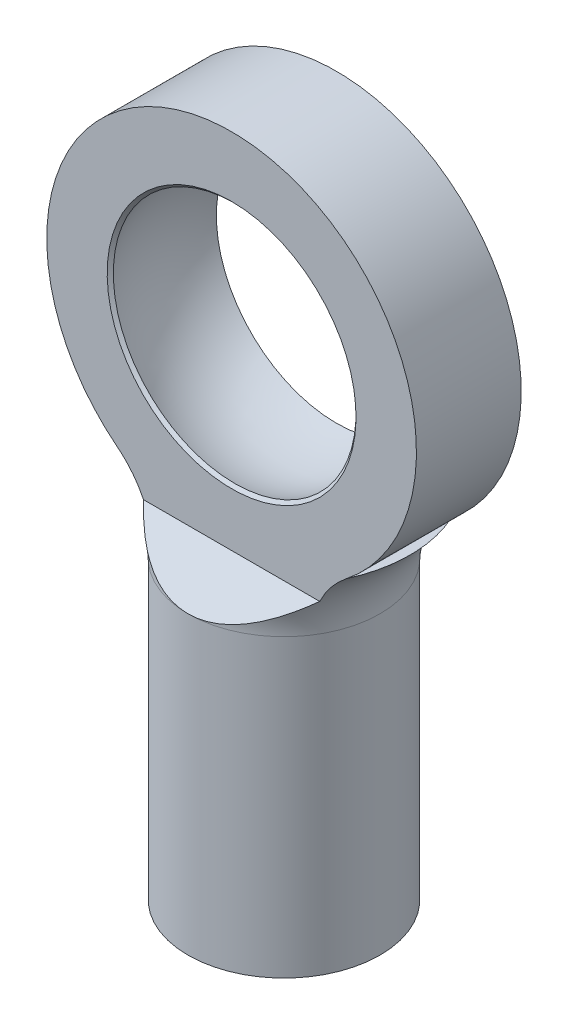
from build123d import *

# Parameters (mm, degrees)
CUT_EXTRUDE1_DEPTH      = 17.454482672
CUT_EXTRUDE1_DEPTH_BACK = 17.454482672
CUT_EXTRUDE2_DEPTH      = 16.750000017
CUT_EXTRUDE2_DEPTH_BACK = 16.750000017
SKETCH3_R               = 3
CHAMFER1_SIZE           = 0.125
CHAMFER1_SIZE2          = 0.094947636
CUT_EXTRUDE3_DEPTH      = 17.079878757
CUT_EXTRUDE3_DEPTH_BACK = 17.079878757
SKETCH7_R               = 1.5
CUT_EXTRUDE4_DEPTH      = 5


with BuildPart() as part:
    # Sketch1 → Revolve1 (revolve)
    with BuildSketch(Plane.XY):
        with BuildLine():
            Line((0, -14.5), (2.75, -14.5))
            Line((2.75, -14.5), (2.75, -6.036348234))
            ThreePointArc((2.75, -6.036348234), (2.97496566, -4.999902987), (3.609375, -4.149989411))
            ThreePointArc((3.609375, -4.149989411), (5.151453278, 1.926792444), (0, 5.5))
            Line((0, 5.5), (0, -14.5))
        make_face()
    revolve(axis=Axis((0, 0, 0), (0, -1, 0)))

    # Sketch2 → Cut-Extrude1 (cut, two sides: drawn at the far end of the back side and taken through both)
    with BuildSketch(Plane(origin=(0, 0, 0), x_dir=(0, 0, -1), z_dir=(1, 0, 0)).offset(-CUT_EXTRUDE1_DEPTH_BACK)):
        Polygon((-6.5, -5.093168822), (-2.75, -6.036348234), (-1.5, -5.093168822), (-1.5, 5.906831178), (-6.5, 5.906831178), align=None)
        Polygon((6.5, 5.906831178), (6.5, -5.093168822), (2.75, -6.036348234), (1.5, -5.093168822), (1.5, 5.906831178), align=None)
    extrude(amount=CUT_EXTRUDE1_DEPTH + CUT_EXTRUDE1_DEPTH_BACK, mode=Mode.SUBTRACT)

    # Sketch3 → Cut-Extrude2 (cut, two sides: drawn at the far end of the back side and taken through both)
    with BuildSketch(Plane.XY.offset(-CUT_EXTRUDE2_DEPTH_BACK)):
        Circle(SKETCH3_R)
    extrude(amount=CUT_EXTRUDE2_DEPTH + CUT_EXTRUDE2_DEPTH_BACK, mode=Mode.SUBTRACT)

    # Sketch5 → Cut-Revolve2 (revolve, cut)
    with BuildSketch(Plane.XY):
        with BuildLine():
            Line((0, 3.75), (0, -3.75))
            ThreePointArc((0, -3.75), (3.75, 0), (0, 3.75))
        make_face()
    revolve(axis=Axis((0, 3.75, 0), (0, -1, 0)), mode=Mode.SUBTRACT)

    # Chamfer1
    chamfer1_edges = [part.edges().sort_by_distance(p)[0] for p in [
        (0, 3.436931771, 1.5),
    ]]
    chamfer1_side = [part.faces().sort_by_distance(p)[0] for p in [
        (0, -4.944898323, 1.5),
    ]]
    chamfer(chamfer1_edges, length=CHAMFER1_SIZE, length2=CHAMFER1_SIZE2, reference=chamfer1_side[0])

    # Sketch6 → Cut-Extrude3 (cut, two sides: drawn at the far end of the back side and taken through both)
    with BuildSketch(Plane.XY.offset(1.5).offset(-CUT_EXTRUDE3_DEPTH_BACK)):
        with BuildLine():
            Line((-3.609375, -4.149989411), (-3.28292368, -4.149989411))
            ThreePointArc((-3.28292368, -4.149989411), (0, 5.291502622), (3.28292368, -4.149989411))
            Line((3.28292368, -4.149989411), (3.609375, -4.149989411))
            ThreePointArc((3.609375, -4.149989411), (0, 5.5), (-3.609375, -4.149989411))
        make_face()
    extrude(amount=CUT_EXTRUDE3_DEPTH + CUT_EXTRUDE3_DEPTH_BACK, mode=Mode.SUBTRACT)

    # Sketch7 → Cut-Extrude4 (cut)
    with BuildSketch(Plane.XZ.offset(14.5)):
        Circle(SKETCH7_R)
    extrude(amount=-CUT_EXTRUDE4_DEPTH, mode=Mode.SUBTRACT)


solid = part.part
